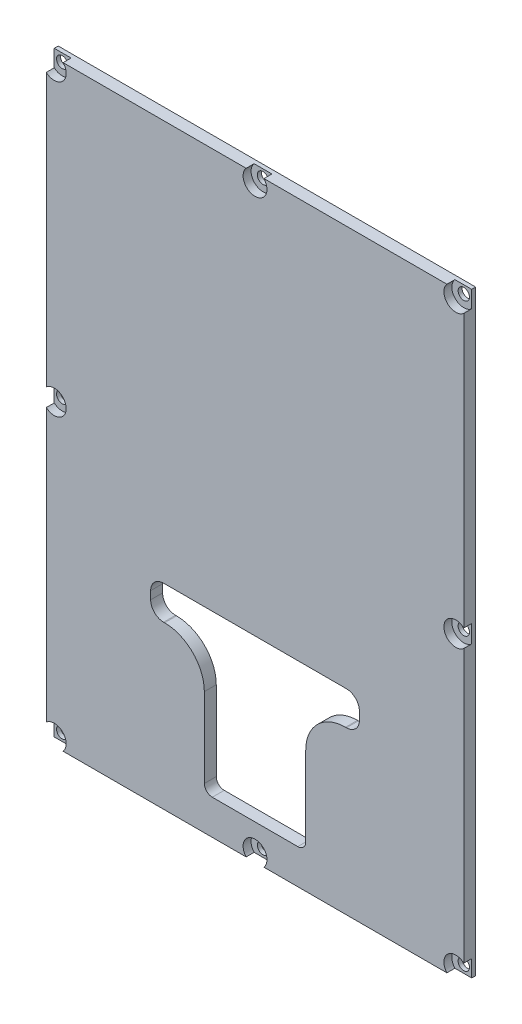
from build123d import *

# Parameters (mm, degrees)
SKETCH_1_W          = 105
SKETCH_1_H          = 150
EXTRUDE_1_DEPTH     = 3
CUT_EXTRUDE_1_DEPTH = 10
SKETCH_3_R          = 3
CUT_EXTRUDE_2_DEPTH = 2
SKETCH_4_R          = 1.425
CUT_EXTRUDE_3_DEPTH = 2


with BuildPart() as part:
    # Эскиз1 → Бобышка-Вытянуть1 (new body)
    with BuildSketch(Plane.XY):
        Rectangle(SKETCH_1_W, SKETCH_1_H)
    extrude(amount=EXTRUDE_1_DEPTH)

    # Эскиз2 → Вырез-Вытянуть1 (cut)
    with BuildSketch(Plane(origin=(0, 0, 0), x_dir=(-1, 0, 0), z_dir=(0, 0, -1))):
        with BuildLine():
            Line((-26.25, -29), (-26.25, -31))
            ThreePointArc((-26.25, -31), (-25.298097039, -33.298097039), (-23, -34.25))
            Line((-23, -34.25), (-22.75, -34.25))
            ThreePointArc((-22.75, -34.25), (-15.678932188, -37.178932188), (-12.75, -44.25))
            Line((-12.75, -44.25), (-12.75, -64.25))
            ThreePointArc((-12.75, -64.25), (-12.164213562, -65.664213562), (-10.75, -66.25))
            Line((-10.75, -66.25), (10.75, -66.25))
            ThreePointArc((10.75, -66.25), (12.164213562, -65.664213562), (12.75, -64.25))
            Line((12.75, -64.25), (12.75, -44.25))
            ThreePointArc((12.75, -44.25), (15.678932188, -37.178932188), (22.75, -34.25))
            Line((22.75, -34.25), (23, -34.25))
            ThreePointArc((23, -34.25), (25.298097039, -33.298097039), (26.25, -31))
            Line((26.25, -31), (26.25, -29))
            ThreePointArc((26.25, -29), (25.298097039, -26.701902961), (23, -25.75))
            Line((23, -25.75), (-23, -25.75))
            ThreePointArc((-23, -25.75), (-25.298097039, -26.701902961), (-26.25, -29))
        make_face()
    extrude(amount=-CUT_EXTRUDE_1_DEPTH, mode=Mode.SUBTRACT)

    # Эскиз3 → Вырез-Вытянуть2 (cut)
    with BuildSketch(Plane.XY.offset(3)):
        with Locations((-50.5, 73)):
            Circle(SKETCH_3_R)
        with Locations((0, 73)):
            Circle(SKETCH_3_R)
        with Locations((50.5, 73)):
            Circle(SKETCH_3_R)
        with Locations((50.5, 0)):
            Circle(SKETCH_3_R)
        with Locations((50.5, -73)):
            Circle(SKETCH_3_R)
        with Locations((0, -73)):
            Circle(SKETCH_3_R)
        with Locations((-50.5, -73)):
            Circle(SKETCH_3_R)
        with Locations((-50.5, 0)):
            Circle(SKETCH_3_R)
    extrude(amount=-CUT_EXTRUDE_2_DEPTH, mode=Mode.SUBTRACT)

    # Эскиз4 → Вырез-Вытянуть3 (cut)
    with BuildSketch(Plane.XY.offset(1)):
        with Locations((-50.5, 73)):
            Circle(SKETCH_4_R)
        with Locations((0, 73)):
            Circle(SKETCH_4_R)
        with Locations((50.5, 73)):
            Circle(SKETCH_4_R)
        with Locations((50.5, 0)):
            Circle(SKETCH_4_R)
        with Locations((50.5, -73)):
            Circle(SKETCH_4_R)
        with Locations((0, -73)):
            Circle(SKETCH_4_R)
        with Locations((-50.5, -73)):
            Circle(SKETCH_4_R)
        with Locations((-50.5, 0)):
            Circle(SKETCH_4_R)
    extrude(amount=-CUT_EXTRUDE_3_DEPTH, mode=Mode.SUBTRACT)


solid = part.part
